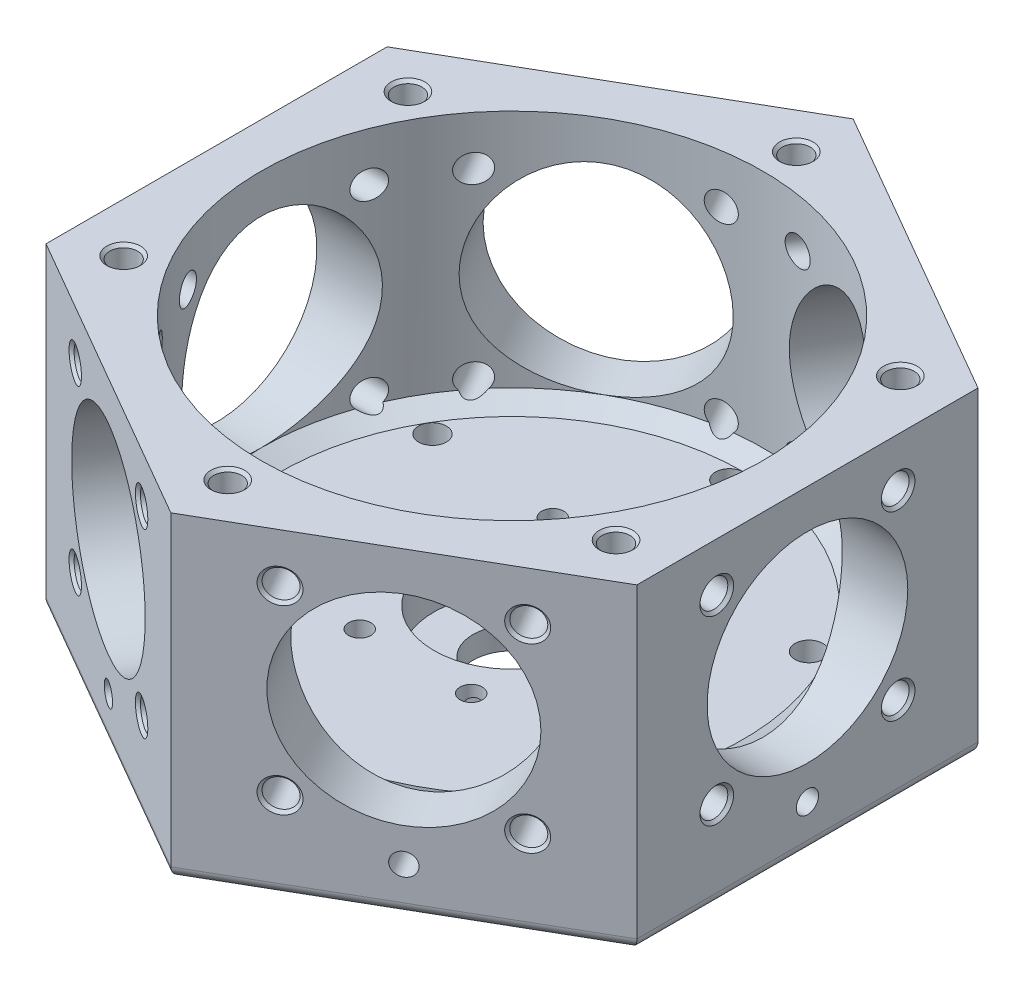
from build123d import *

# Parameters (mm, degrees)
BOSS_EXTRUDE1_DEPTH      = 25
BOSS_EXTRUDE1_DEPTH_BACK = 32
SKETCH2_R                = 45
CUT_EXTRUDE1_DEPTH       = 45
CUT_EXTRUDE2_REACH       = 139.165
CUT_EXTRUDE2_END_RADIUS  = 45
SKETCH3_R                = 18
CIRPATTERN1_COUNT        = 6
CHAMFER1_SIZE            = 2
CHAMFER1_SIZE2           = 3.464101615
FILLET1_R                = 2
CIRPATTERN3_COUNT        = 6
CIRPATTERN4_COUNT        = 4
CIRPATTERN5_COUNT        = 6
CIRPATTERN6_COUNT        = 6
SKETCH13_R               = 2
CUT_EXTRUDE3_DEPTH       = 100.011783922
SKETCH14_R               = 2
CUT_EXTRUDE4_DEPTH       = 36
CIRPATTERN7_COUNT        = 6
SKETCH15_R               = 7
CUT_EXTRUDE5_DEPTH       = 100.011783922
SKETCH16_R               = 14
CUT_EXTRUDE6_DEPTH       = 8


with BuildPart() as part:
    # Sketch1 → Boss-Extrude1 (new, two sides: drawn at the far end of the back side and taken through both)
    with BuildSketch(Plane(origin=(0, 0, 0), x_dir=(1, 0, 0), z_dir=(0, 1, 0)).offset(-BOSS_EXTRUDE1_DEPTH_BACK)):
        Polygon((-53, 30.599564267), (-53, -30.599564267), (0, -61.199128534), (53, -30.599564267), (53, 30.599564267), (0, 61.199128534), align=None)
    extrude(amount=BOSS_EXTRUDE1_DEPTH + BOSS_EXTRUDE1_DEPTH_BACK)

    # Sketch2 → Cut-Extrude1 (cut)
    with BuildSketch(Plane(origin=(0, 25, 0), x_dir=(1, 0, 0), z_dir=(0, 1, 0))):
        with Locations(Location((0, 0, 0), (0, 0, 270))):
            Circle(SKETCH2_R)
    extrude(amount=-CUT_EXTRUDE1_DEPTH, mode=Mode.SUBTRACT)

    # Cut-Extrude2: up to this cylinder (the profile starts outside it)
    cut_extrude2_end = Plane(origin=(0, 0, 0), z_dir=(0, 1, 0)) * Cylinder(CUT_EXTRUDE2_END_RADIUS, 369.33, mode=Mode.PRIVATE)
    # Sketch3 → Cut-Extrude2 (cut, up to the surface)
    with BuildSketch(Plane(origin=(-26.5, 0, 45.899346401), x_dir=(0.8660254037844384, 0, 0.5000000000000006), z_dir=(-0.5000000000000006, 0, 0.8660254037844385)), mode=Mode.PRIVATE) as cut_extrude2_sk1:
        Circle(SKETCH3_R)
    cut_extrude2_tool1 = extrude(cut_extrude2_sk1.sketch, amount=-CUT_EXTRUDE2_REACH, mode=Mode.PRIVATE) - cut_extrude2_end
    cut_extrude2 = cut_extrude2_tool1.solids().sort_by_distance((-26.5, 0, 45.899346))[0]
    add(cut_extrude2, mode=Mode.SUBTRACT)

    # CirPattern1: Cut-Extrude2 ×6 about axis
    cirpattern1_axis = Axis((0, -20, 0), (0, 1, 0))
    for i in range(1, CIRPATTERN1_COUNT):
        add(cut_extrude2.rotate(cirpattern1_axis, i * 360 / CIRPATTERN1_COUNT), mode=Mode.SUBTRACT)

    # Chamfer1
    chamfer1_edges = [part.edges().sort_by_distance(p)[0] for p in [
        (0, -20, -45),
    ]]
    chamfer1_side = [part.faces().sort_by_distance(p)[0] for p in [
        (0, 2.5, -45),
    ]]
    chamfer(chamfer1_edges, length=CHAMFER1_SIZE, length2=CHAMFER1_SIZE2, reference=chamfer1_side[0])

    # Fillet1
    fillet1_edges = [part.edges().sort_by_distance(p)[0] for p in [
        (-26.5, -32, 45.899346401),
        (26.5, -32, 45.899346401),
        (53, -32, 0),
        (26.5, -32, -45.899346401),
        (-26.5, -32, -45.899346401),
        (-53, -32, 0),
    ]]
    fillet(fillet1_edges, radius=FILLET1_R)

    # Sketch6 → M6 Tapped Hole1 (revolve, cut)
    with BuildSketch(Plane(origin=(0, 25, -51), x_dir=(0, 0, 1), z_dir=(1, 0, 0))):
        Polygon((0, 0), (0, 13.502151548), (2.5, 12), (2.5, 0.525), (3.025, 0), align=None)
    m6_tapped_hole1 = revolve(axis=Axis((0, 31.35, -51), (0, -1, 0)), mode=Mode.SUBTRACT)

    # CirPattern3: M6 Tapped Hole1 ×6 about axis
    cirpattern3_axis = Axis((0, 0, 0), (0, 1, 0))
    for i in range(1, CIRPATTERN3_COUNT):
        add(m6_tapped_hole1.rotate(cirpattern3_axis, i * 360 / CIRPATTERN3_COUNT), mode=Mode.SUBTRACT)

    # Sketch9 → M6 Tapped Hole2 (revolve, cut)
    with BuildSketch(Plane(origin=(-12.415433979, 16.263455967, 54.031074384), x_dir=(0.8660254037844385, 0, 0.5000000000000006), z_dir=(0, 1, 0))):
        Polygon((0, 0), (0, 16.502151548), (2.5, 15), (2.5, 0.525), (3.025, 0), align=None)
    m6_tapped_hole2 = revolve(axis=Axis((-15.590433979, 16.263455967, 59.530335698), (0.5000000000000004, 0, -0.8660254037844385)), mode=Mode.SUBTRACT)

    # CirPattern4: M6 Tapped Hole2 ×4 about axis
    cirpattern4_axis = Axis((0, 0, 0), (-0.5000000000000004, 0, 0.8660254037844384))
    for i in range(1, CIRPATTERN4_COUNT):
        add(m6_tapped_hole2.rotate(cirpattern4_axis, i * 360 / CIRPATTERN4_COUNT), mode=Mode.SUBTRACT)

    # CirPattern5: M6 Tapped Hole2 ×6 about axis
    cirpattern5_axis = Axis((0, 25, 0), (0, 1, 0))
    for i in range(1, CIRPATTERN5_COUNT):
        add(m6_tapped_hole2.rotate(cirpattern5_axis, i * 360 / CIRPATTERN5_COUNT), mode=Mode.SUBTRACT)

    # CirPattern5 copy 1 sketch → CirPattern5 copy 1 (revolve, cut)
    with BuildSketch(Plane(origin=(12.415433979, 16.263455967, 54.031074384), x_dir=(0, 1, 0), z_dir=(-0.866025403784439, 0, 0.4999999999999994))):
        Polygon((0, 0), (0, 16.502151548), (2.5, 15), (2.5, 0.525), (3.025, 0), align=None)
    revolve(axis=Axis((15.590433979, 16.263455967, 59.530335698), (-0.4999999999999995, 0, -0.866025403784439)), mode=Mode.SUBTRACT)

    # CirPattern5 copy 2 sketch → CirPattern5 copy 2 (revolve, cut)
    with BuildSketch(Plane(origin=(53, 16.263455967, 16.263455967), x_dir=(0, 1, 0), z_dir=(0, 0, 1))):
        Polygon((0, 0), (0, 16.502151548), (2.5, 15), (2.5, 0.525), (3.025, 0), align=None)
    revolve(axis=Axis((59.35, 16.263455967, 16.263455967), (-1, 0, 0)), mode=Mode.SUBTRACT)

    # CirPattern5 copy 3 sketch → CirPattern5 copy 3 (revolve, cut)
    with BuildSketch(Plane(origin=(40.584566021, 16.263455967, -37.767618417), x_dir=(0, 1, 0), z_dir=(0.8660254037844383, 0, 0.5000000000000006))):
        Polygon((0, 0), (0, 16.502151548), (2.5, 15), (2.5, 0.525), (3.025, 0), align=None)
    revolve(axis=Axis((43.759566021, 16.263455967, -43.266879731), (-0.5000000000000006, 0, 0.8660254037844384)), mode=Mode.SUBTRACT)

    # CirPattern5 copy 4 sketch → CirPattern5 copy 4 (revolve, cut)
    with BuildSketch(Plane(origin=(-12.415433979, 16.263455967, -54.031074384), x_dir=(0, 1, 0), z_dir=(0.8660254037844392, 0, -0.4999999999999991))):
        Polygon((0, 0), (0, 16.502151548), (2.5, 15), (2.5, 0.525), (3.025, 0), align=None)
    revolve(axis=Axis((-15.590433979, 16.263455967, -59.530335698), (0.4999999999999992, 0, 0.8660254037844392)), mode=Mode.SUBTRACT)

    # CirPattern5 copy 5 sketch → CirPattern5 copy 5 (revolve, cut)
    with BuildSketch(Plane(origin=(-53, 16.263455967, -16.263455967), x_dir=(0, 1, 0), z_dir=(0, 0, -1))):
        Polygon((0, 0), (0, 16.502151548), (2.5, 15), (2.5, 0.525), (3.025, 0), align=None)
    revolve(axis=Axis((-59.35, 16.263455967, -16.263455967), (1, 0, 0)), mode=Mode.SUBTRACT)

    # CirPattern5 copy 6 sketch → CirPattern5 copy 6 (revolve, cut)
    with BuildSketch(Plane(origin=(12.415433979, -16.263455967, 54.031074384), x_dir=(-0.866025403784439, 0, 0.49999999999999956), z_dir=(0, -1, 0))):
        Polygon((0, 0), (0, 16.502151548), (2.5, 15), (2.5, 0.525), (3.025, 0), align=None)
    revolve(axis=Axis((15.590433979, -16.263455967, 59.530335698), (-0.49999999999999944, 0, -0.866025403784439)), mode=Mode.SUBTRACT)

    # CirPattern5 copy 7 sketch → CirPattern5 copy 7 (revolve, cut)
    with BuildSketch(Plane(origin=(53, -16.263455967, 16.263455967), x_dir=(0, 0, 1), z_dir=(0, -1, 0))):
        Polygon((0, 0), (0, 16.502151548), (2.5, 15), (2.5, 0.525), (3.025, 0), align=None)
    revolve(axis=Axis((59.35, -16.263455967, 16.263455967), (-1, 0, 0)), mode=Mode.SUBTRACT)

    # CirPattern5 copy 8 sketch → CirPattern5 copy 8 (revolve, cut)
    with BuildSketch(Plane(origin=(40.584566021, -16.263455967, -37.767618417), x_dir=(0.8660254037844385, 0, 0.5000000000000007), z_dir=(0, -1, 0))):
        Polygon((0, 0), (0, 16.502151548), (2.5, 15), (2.5, 0.525), (3.025, 0), align=None)
    revolve(axis=Axis((43.759566021, -16.263455967, -43.266879731), (-0.5000000000000007, 0, 0.8660254037844384)), mode=Mode.SUBTRACT)

    # CirPattern5 copy 9 sketch → CirPattern5 copy 9 (revolve, cut)
    with BuildSketch(Plane(origin=(-12.415433979, -16.263455967, -54.031074384), x_dir=(0.8660254037844393, 0, -0.4999999999999992), z_dir=(0, -1, 0))):
        Polygon((0, 0), (0, 16.502151548), (2.5, 15), (2.5, 0.525), (3.025, 0), align=None)
    revolve(axis=Axis((-15.590433979, -16.263455967, -59.530335698), (0.4999999999999991, 0, 0.8660254037844393)), mode=Mode.SUBTRACT)

    # CirPattern5 copy 10 sketch → CirPattern5 copy 10 (revolve, cut)
    with BuildSketch(Plane(origin=(-53, -16.263455967, -16.263455967), x_dir=(0, 0, -1), z_dir=(0, -1, 0))):
        Polygon((0, 0), (0, 16.502151548), (2.5, 15), (2.5, 0.525), (3.025, 0), align=None)
    revolve(axis=Axis((-59.35, -16.263455967, -16.263455967), (1, 0, 0)), mode=Mode.SUBTRACT)

    # CirPattern5 copy 11 sketch → CirPattern5 copy 11 (revolve, cut)
    with BuildSketch(Plane(origin=(40.584566021, -16.263455967, 37.767618417), x_dir=(0, -1, 0), z_dir=(0.866025403784439, 0, -0.4999999999999994))):
        Polygon((0, 0), (0, 16.502151548), (2.5, 15), (2.5, 0.525), (3.025, 0), align=None)
    revolve(axis=Axis((43.759566021, -16.263455967, 43.266879731), (-0.4999999999999994, 0, -0.866025403784439)), mode=Mode.SUBTRACT)

    # CirPattern5 copy 12 sketch → CirPattern5 copy 12 (revolve, cut)
    with BuildSketch(Plane(origin=(53, -16.263455967, -16.263455967), x_dir=(0, -1, 0), z_dir=(0, 0, -1))):
        Polygon((0, 0), (0, 16.502151548), (2.5, 15), (2.5, 0.525), (3.025, 0), align=None)
    revolve(axis=Axis((59.35, -16.263455967, -16.263455967), (-1, 0, 0)), mode=Mode.SUBTRACT)

    # CirPattern5 copy 13 sketch → CirPattern5 copy 13 (revolve, cut)
    with BuildSketch(Plane(origin=(12.415433979, -16.263455967, -54.031074384), x_dir=(0, -1, 0), z_dir=(-0.8660254037844383, 0, -0.5000000000000006))):
        Polygon((0, 0), (0, 16.502151548), (2.5, 15), (2.5, 0.525), (3.025, 0), align=None)
    revolve(axis=Axis((15.590433979, -16.263455967, -59.530335698), (-0.5000000000000007, 0, 0.8660254037844384)), mode=Mode.SUBTRACT)

    # CirPattern5 copy 14 sketch → CirPattern5 copy 14 (revolve, cut)
    with BuildSketch(Plane(origin=(-40.584566021, -16.263455967, -37.767618417), x_dir=(0, -1, 0), z_dir=(-0.8660254037844392, 0, 0.4999999999999991))):
        Polygon((0, 0), (0, 16.502151548), (2.5, 15), (2.5, 0.525), (3.025, 0), align=None)
    revolve(axis=Axis((-43.759566021, -16.263455967, -43.266879731), (0.4999999999999991, 0, 0.8660254037844392)), mode=Mode.SUBTRACT)

    # CirPattern5 copy 15 sketch → CirPattern5 copy 15 (revolve, cut)
    with BuildSketch(Plane(origin=(-53, -16.263455967, 16.263455967), x_dir=(0, -1, 0), z_dir=(0, 0, 1))):
        Polygon((0, 0), (0, 16.502151548), (2.5, 15), (2.5, 0.525), (3.025, 0), align=None)
    revolve(axis=Axis((-59.35, -16.263455967, 16.263455967), (1, 0, 0)), mode=Mode.SUBTRACT)

    # Sketch12 → M6 Tapped Hole3 (revolve, cut)
    with BuildSketch(Plane(origin=(0, -32, 39), x_dir=(0, 0, -1), z_dir=(1, 0, 0))):
        Polygon((0, 0), (0, 16.502151548), (2.5, 15), (2.5, 0.525), (3.025, 0), align=None)
    m6_tapped_hole3 = revolve(axis=Axis((0, -38.35, 39), (0, 1, 0)), mode=Mode.SUBTRACT)

    # CirPattern6: M6 Tapped Hole3 ×6 about axis
    cirpattern6_axis = Axis((0, 0, 0), (0, 1, 0))
    for i in range(1, CIRPATTERN6_COUNT):
        add(m6_tapped_hole3.rotate(cirpattern6_axis, i * 360 / CIRPATTERN6_COUNT), mode=Mode.SUBTRACT)

    # Sketch13 → Cut-Extrude3 (cut, through all)
    with BuildSketch(Plane.XZ.offset(32)):
        with Locations(Location((20, 0, 0), (0, 0, 270))):
            Circle(SKETCH13_R)
        with Locations(Location((10, -17.320508076, 0), (0, 0, 270))):
            Circle(SKETCH13_R)
        with Locations(Location((-10, -17.320508076, 0), (0, 0, 270))):
            Circle(SKETCH13_R)
        with Locations(Location((-20, 0, 0), (0, 0, 270))):
            Circle(SKETCH13_R)
        with Locations(Location((-10, 17.320508076, 0), (0, 0, 270))):
            Circle(SKETCH13_R)
        with Locations(Location((10, 17.320508076, 0), (0, 0, 270))):
            Circle(SKETCH13_R)
    extrude(amount=-CUT_EXTRUDE3_DEPTH, mode=Mode.SUBTRACT)

    # Sketch14 → Cut-Extrude4 (cut)
    with BuildSketch(Plane(origin=(53, 0, 0), x_dir=(0, 0, -1), z_dir=(1, 0, 0))):
        with Locations((0, -24)):
            Circle(SKETCH14_R)
    cut_extrude4 = extrude(amount=-CUT_EXTRUDE4_DEPTH, mode=Mode.SUBTRACT)

    # CirPattern7: Cut-Extrude4 ×6 about axis
    cirpattern7_axis = Axis((0, 0, 0), (0, 1, 0))
    for i in range(1, CIRPATTERN7_COUNT):
        add(cut_extrude4.rotate(cirpattern7_axis, i * 360 / CIRPATTERN7_COUNT), mode=Mode.SUBTRACT)

    # Sketch15 → Cut-Extrude5 (cut, through all)
    with BuildSketch(Plane.XZ.offset(32)):
        with Locations(Location((0, 0, 0), (0, 0, 270))):
            Circle(SKETCH15_R)
    extrude(amount=-CUT_EXTRUDE5_DEPTH, mode=Mode.SUBTRACT)

    # Sketch16 → Cut-Extrude6 (cut)
    with BuildSketch(Plane(origin=(0, -20, 0), x_dir=(1, 0, 0), z_dir=(0, 1, 0))):
        with Locations(Location((0, 0, 0), (0, 0, 270))):
            Circle(SKETCH16_R)
    extrude(amount=-CUT_EXTRUDE6_DEPTH, mode=Mode.SUBTRACT)


solid = part.part
